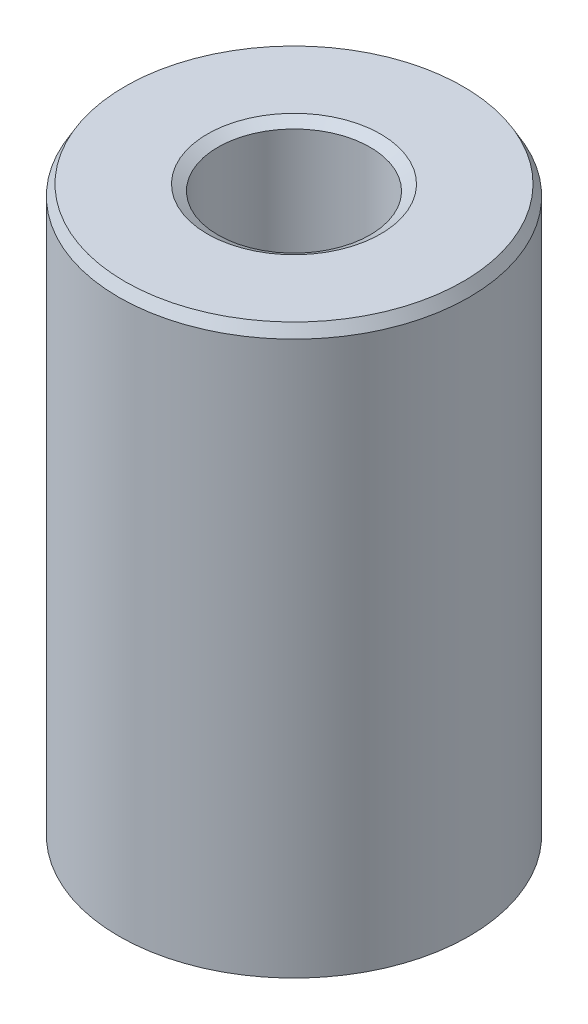
from build123d import *
from OCP.BRepFilletAPI import BRepFilletAPI_MakeChamfer

# Parameters (mm, degrees)
SKETCH1_R           = 55
BOSS_EXTRUDE1_DEPTH = 178.997872923
SKETCH2_R           = 23.889627957
CUT_EXTRUDE1_DEPTH  = 196.167206546
CHAMFER1_SIZE       = 3.318412501
CHAMFER1_SIZE2      = 1.915886351


with BuildPart() as part:
    # Sketch1 → Boss-Extrude1 (new body)
    with BuildSketch(Plane(origin=(0, 0, 0), x_dir=(1, 0, 0), z_dir=(0, 1, 0))):
        Circle(SKETCH1_R)
    extrude(amount=BOSS_EXTRUDE1_DEPTH)

    # Sketch2 → Cut-Extrude1 (cut, through all)
    with BuildSketch(Plane(origin=(0, 0, 0), x_dir=(1, 0, 0), z_dir=(0, 1, 0))):
        Circle(SKETCH2_R)
    extrude(amount=CUT_EXTRUDE1_DEPTH, mode=Mode.SUBTRACT)

    # Chamfer1: one chamfer whose edges measure the first distance from different faces: ONE call of the kernel's chamfer builder (chamfer() names one face for all edges)
    chamfer1_edges_1 = [part.edges().sort_by_distance(p)[0] for p in [
        (-23.889627957, 178.997872923, 0),
    ]]
    chamfer1_side_1 = [part.faces().sort_by_distance(p)[0] for p in [
        (-53.444365081, 178.997872923, 0),
    ]]
    chamfer1_edges_2 = [part.edges().sort_by_distance(p)[0] for p in [
        (-23.889627957, 0, 0),
    ]]
    chamfer1_side_2 = [part.faces().sort_by_distance(p)[0] for p in [
        (-23.889627957, 89.498936462, 0),
    ]]
    chamfer1_edges_3 = [part.edges().sort_by_distance(p)[0] for p in [
        (-55, 0, 0),
    ]]
    chamfer1_side_3 = [part.faces().sort_by_distance(p)[0] for p in [
        (-53.444365081, 0, 0),
    ]]
    chamfer1_edges_4 = [part.edges().sort_by_distance(p)[0] for p in [
        (-55, 178.997872923, 0),
    ]]
    chamfer1_side_4 = [part.faces().sort_by_distance(p)[0] for p in [
        (-55, 89.498936462, 0),
    ]]
    chamfer1 = BRepFilletAPI_MakeChamfer(part.part.solid().wrapped)
    for e in chamfer1_edges_1:
        chamfer1.Add(CHAMFER1_SIZE, CHAMFER1_SIZE2, e.wrapped, chamfer1_side_1[0].wrapped)  # the first distance lies on this face
    for e in chamfer1_edges_2:
        chamfer1.Add(CHAMFER1_SIZE, CHAMFER1_SIZE2, e.wrapped, chamfer1_side_2[0].wrapped)  # the first distance lies on this face
    for e in chamfer1_edges_3:
        chamfer1.Add(CHAMFER1_SIZE, CHAMFER1_SIZE2, e.wrapped, chamfer1_side_3[0].wrapped)  # the first distance lies on this face
    for e in chamfer1_edges_4:
        chamfer1.Add(CHAMFER1_SIZE, CHAMFER1_SIZE2, e.wrapped, chamfer1_side_4[0].wrapped)  # the first distance lies on this face
    add(Compound.cast(chamfer1.Shape()), mode=Mode.REPLACE)


solid = part.part
